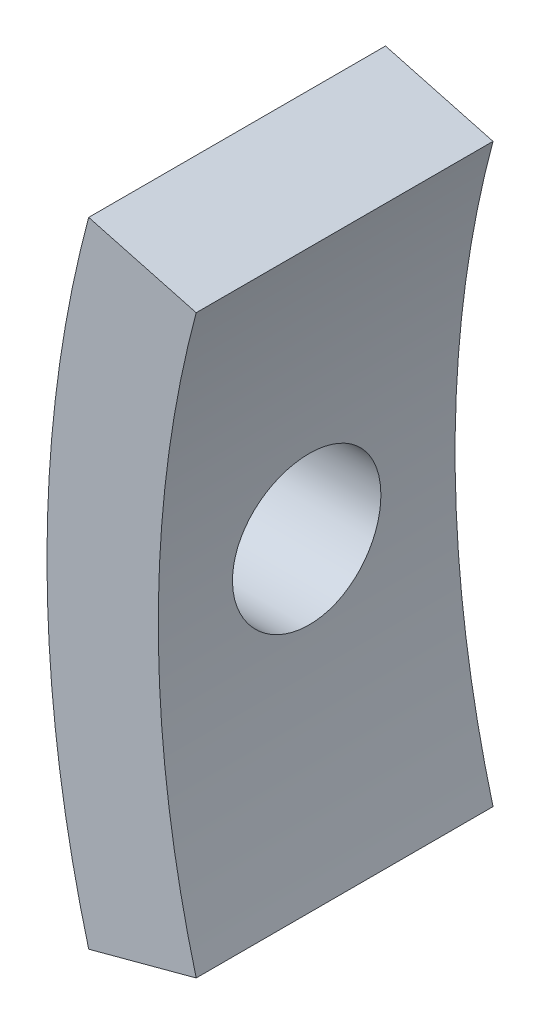
from build123d import *

# Parameters (mm, degrees)
BOSS_EXTRUDE1_DEPTH     = 10
CUT_EXTRUDE1_DEPTH      = 44.76694614
CUT_EXTRUDE1_DEPTH_BACK = 44.76694614
SKETCH2_R               = 2.5


with BuildPart() as part:
    # Sketch1 → Boss-Extrude1 (new body)
    with BuildSketch(Plane(origin=(0, 0, 0), x_dir=(0, 1, 0), z_dir=(0, 0, 1))):
        with BuildLine():
            Line((-10.67628561, 39.844440334), (-9.705714191, 36.222218486))
            ThreePointArc((-9.705714191, 36.222218486), (0, 37.5), (9.705714191, 36.222218486))
            Line((9.705714191, 36.222218486), (10.67628561, 39.844440334))
            ThreePointArc((10.67628561, 39.844440334), (0, 41.25), (-10.67628561, 39.844440334))
        make_face()
    extrude(amount=BOSS_EXTRUDE1_DEPTH)

    # Sketch2 → Cut-Extrude1 (cut, two sides: drawn at the far end of the back side and taken through both)
    with BuildSketch(Plane.YZ.offset(-CUT_EXTRUDE1_DEPTH_BACK)):
        with Locations((0, 5)):
            Circle(SKETCH2_R)
    extrude(amount=CUT_EXTRUDE1_DEPTH + CUT_EXTRUDE1_DEPTH_BACK, mode=Mode.SUBTRACT)


solid = part.part
